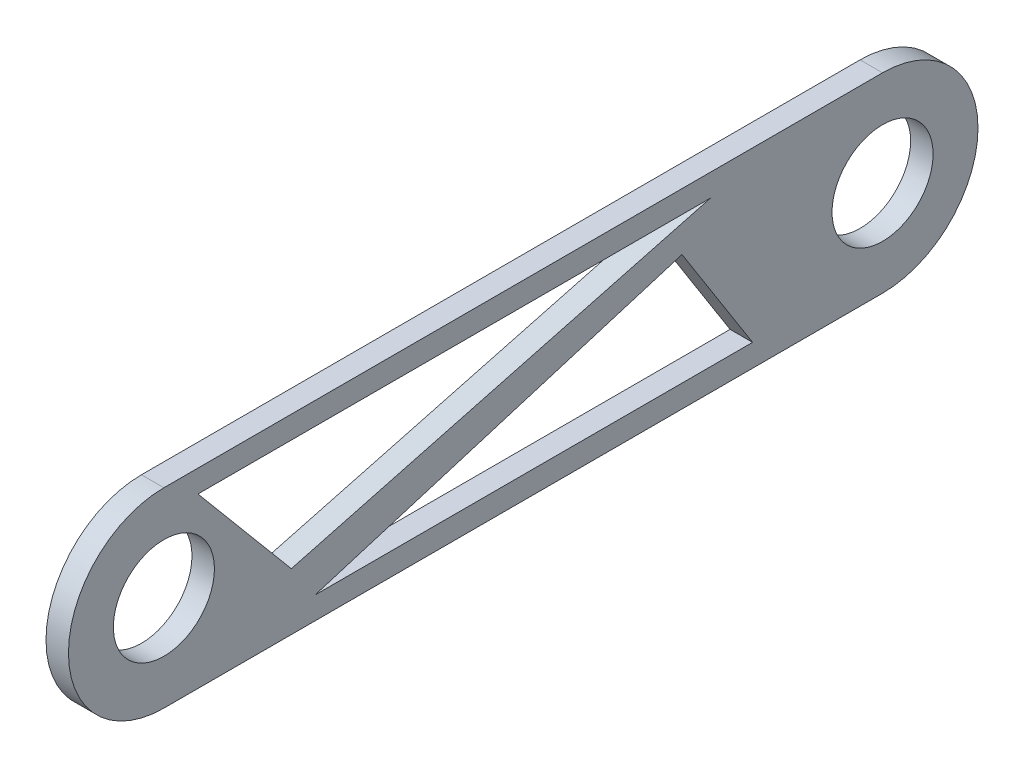
from build123d import *

# Parameters (mm, degrees)
SKETCH1_R           = 14.2875
BOSS_EXTRUDE1_DEPTH = 6.35


with BuildPart() as part:
    # Sketch1 → Boss-Extrude1 (new body)
    with BuildSketch(Plane(origin=(0, 0, 0), x_dir=(0, 0, -1), z_dir=(1, 0, 0))):
        with BuildLine():
            Line((203.2, 26.9875), (0, 26.9875))
            ThreePointArc((0, 26.9875), (-26.9875, 0), (0, -26.9875))
            Line((0, -26.9875), (203.2, -26.9875))
            ThreePointArc((203.2, -26.9875), (230.1875, 0), (203.2, 26.9875))
        make_face()
        Polygon((146.487365437, 10.845731969), (166.448840187, -20.6375), (42.777895421, -20.6375), align=None, mode=Mode.SUBTRACT)
        Circle(SKETCH1_R, mode=Mode.SUBTRACT)
        Polygon((36.034140732, -10.845731969), (9.625519738, 20.6375), (154.559249322, 20.6375), align=None, mode=Mode.SUBTRACT)
        with Locations((203.2, 0)):
            Circle(SKETCH1_R, mode=Mode.SUBTRACT)
    extrude(amount=BOSS_EXTRUDE1_DEPTH)


solid = part.part
